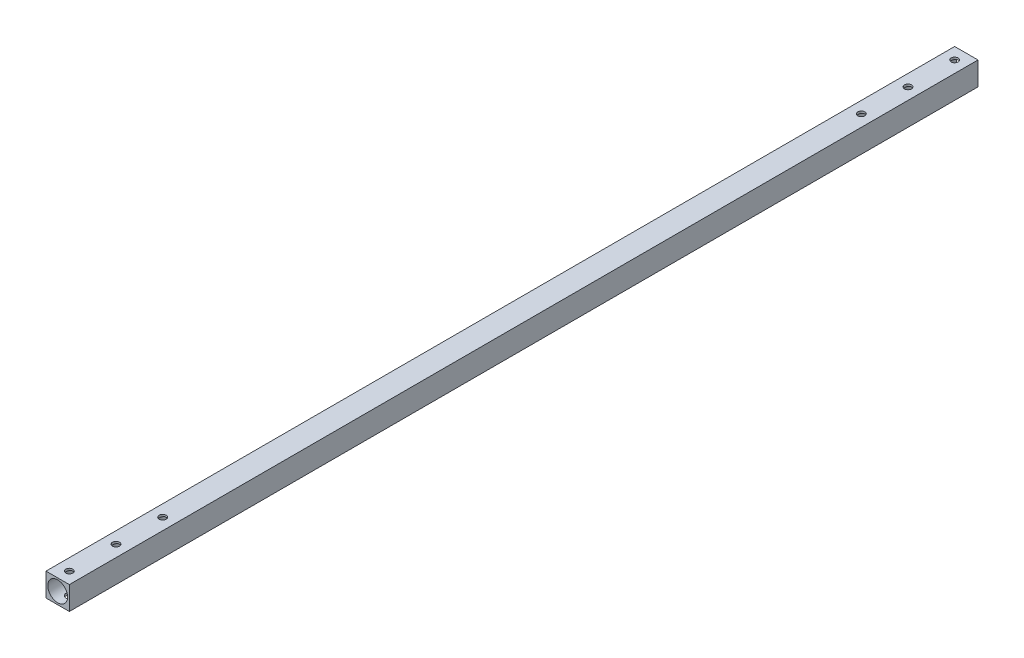
from build123d import *

# Parameters (mm, degrees)
SKETCH1_W           = 10
SKETCH1_H           = 10
SKETCH1_R           = 4.25
BOSS_EXTRUDE1_DEPTH = 389.4
SKETCH2_R           = 1.5
CUT_EXTRUDE1_DEPTH  = 390.560470274


with BuildPart() as part:
    # Sketch1 → Boss-Extrude1 (new body)
    with BuildSketch(Plane.XY):
        Rectangle(SKETCH1_W, SKETCH1_H)
        Circle(SKETCH1_R, mode=Mode.SUBTRACT)
    extrude(amount=BOSS_EXTRUDE1_DEPTH)

    # Sketch2 → Cut-Extrude1 (cut, through all)
    with BuildSketch(Plane(origin=(0, 5, 0), x_dir=(1, 0, 0), z_dir=(0, 1, 0))):
        with Locations((0, -5)):
            Circle(SKETCH2_R)
        with Locations((0, -25)):
            Circle(SKETCH2_R)
        with Locations((0, -45)):
            Circle(SKETCH2_R)
        with Locations((0, -384.4)):
            Circle(SKETCH2_R)
        with Locations((0, -364.4)):
            Circle(SKETCH2_R)
        with Locations((0, -344.4)):
            Circle(SKETCH2_R)
    extrude(amount=-CUT_EXTRUDE1_DEPTH, mode=Mode.SUBTRACT)


solid = part.part
